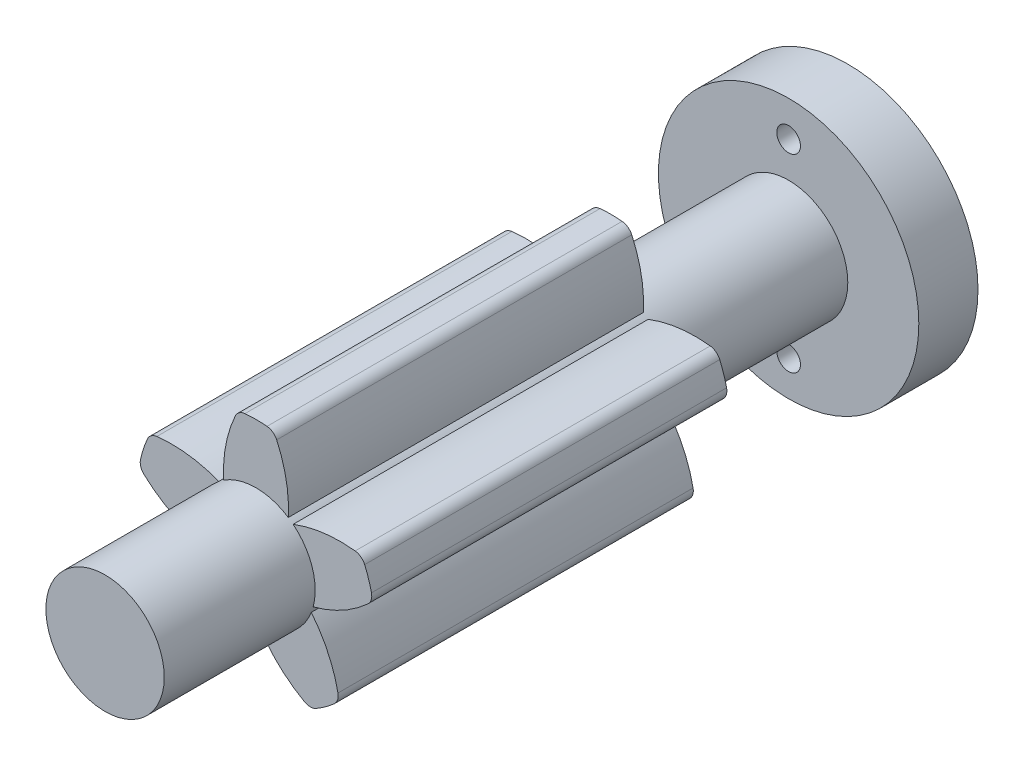
from build123d import *

# Parameters (mm, degrees)
ESQUISSE1_R                        = 11
BOSS_EXTRU_1_DEPTH                 = 5
ESQUISSE2_R                        = 1
ENL_V_MAT_EXTRU_1_DEPTH            = 17.340134638
ESQUISSE3_R                        = 5
BOSS_EXTRU_2_DEPTH                 = 57.75
BOSS_EXTRU_3_DEPTH                 = 15
CONG_1_R                           = 1
R_P_TITION_CIRCULAIRE1_COUNT       = 5
CONG_1_OF_R_P_TITION_CIRCULAIRE1_R = 1


with BuildPart() as part:
    # Esquisse1 → Boss.-Extru.1 (new body)
    with BuildSketch(Plane.XY):
        Circle(ESQUISSE1_R)
    extrude(amount=BOSS_EXTRU_1_DEPTH)

    # Esquisse2 → Enlèv. mat.-Extru.1 (cut, through all)
    with BuildSketch(Plane.XY.offset(5)):
        with Locations((0, 8)):
            Circle(ESQUISSE2_R)
        with Locations((0, -8)):
            Circle(ESQUISSE2_R)
    extrude(amount=-ENL_V_MAT_EXTRU_1_DEPTH, mode=Mode.SUBTRACT)

    # Esquisse3 → Boss.-Extru.2 (add)
    with BuildSketch(Plane.XY.offset(5)):
        Circle(ESQUISSE3_R)
    extrude(amount=BOSS_EXTRU_2_DEPTH)

    # Esquisse4 → Boss.-Extru.3 (add, symmetric)
    with BuildSketch(Plane.XY.offset(35)):
        with BuildLine():
            ThreePointArc((-2.731158071, 4.188170912), (-2.5, 7.120566641), (-1.5, 9.886859967))
            ThreePointArc((-1.5, 9.886859967), (0, 10), (1.5, 9.886859967))
            ThreePointArc((1.5, 9.886859967), (2.5, 7.120566641), (2.731158071, 4.188170912))
            ThreePointArc((2.731158071, 4.188170912), (0, -5), (-2.731158071, 4.188170912))
        make_face()
    boss_extru_3 = extrude(amount=BOSS_EXTRU_3_DEPTH, both=True)

    # Congé1
    cong_1_edges = [part.edges().sort_by_distance(p)[0] for p in [
        (1.5, 9.886859967, 35),
        (-1.5, 9.886859967, 35),
    ]]
    fillet(cong_1_edges, radius=CONG_1_R)

    # Répétition circulaire1: Boss.-Extru.3 ×5 about axis
    r_p_tition_circulaire1_axis = Axis((0, 0, 62.75), (0, 0, -1))
    for i in range(1, R_P_TITION_CIRCULAIRE1_COUNT):
        add(boss_extru_3.rotate(r_p_tition_circulaire1_axis, i * 360 / R_P_TITION_CIRCULAIRE1_COUNT))

    # Congé1 of Répétition circulaire1
    cong_1_of_r_p_tition_circulaire1_edges = [part.edges().sort_by_distance(p)[0] for p in [
        (9.866488089, 1.628622976, 35),
        (8.939437105, 4.481792525, 35),
        (4.597824988, -8.880315612, 35),
        (7.024875971, -7.116959856, 35),
        (-7.024875971, -7.116959856, 35),
        (-4.597824988, -8.880315612, 35),
        (-8.939437105, 4.481792525, 35),
        (-9.866488089, 1.628622976, 35),
    ]]
    fillet(cong_1_of_r_p_tition_circulaire1_edges, radius=CONG_1_OF_R_P_TITION_CIRCULAIRE1_R)


solid = part.part
